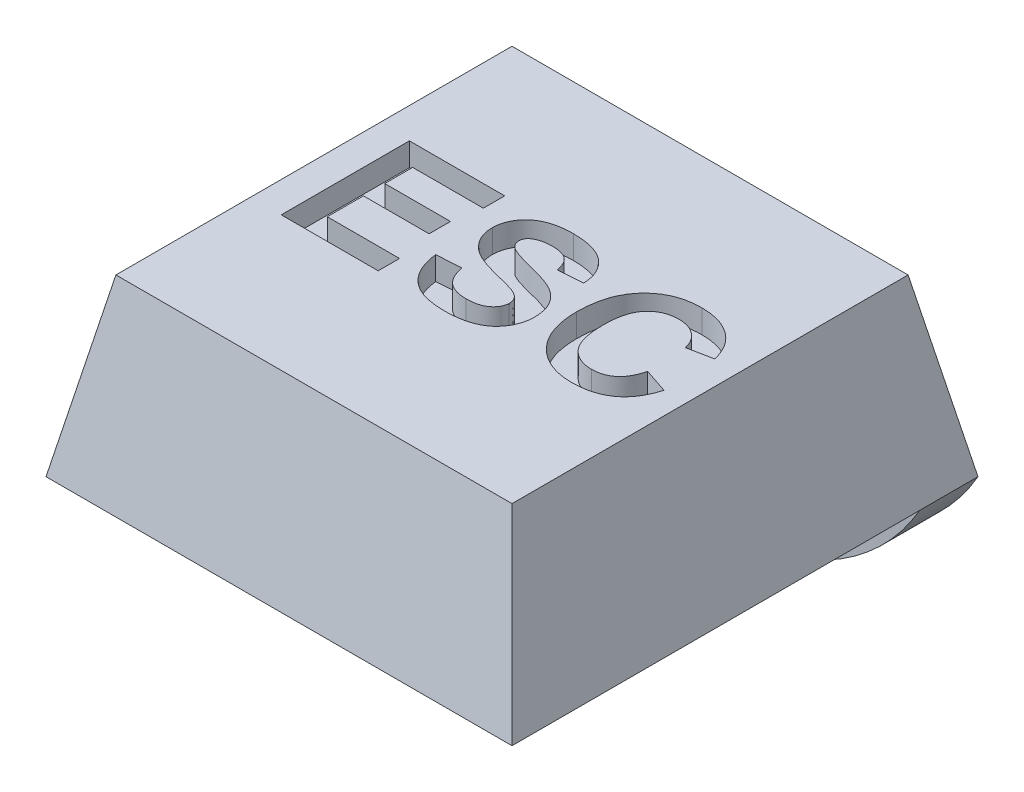
from build123d import *

# Parameters (mm, degrees)
SKETCH1_W               = 8
SKETCH1_H               = 8
BOSS_EXTRUDE1_DEPTH     = 3
CUT_EXTRUDE1_DEPTH      = 12.704699911
CUT_EXTRUDE1_DEPTH_BACK = 12.704699911
CUT_EXTRUDE2_DEPTH      = 11
SKETCH4_R               = 1.8
CUT_EXTRUDE3_DEPTH      = 0.8
SKETCH5_W               = 8
SKETCH5_H               = 1
BOSS_EXTRUDE2_DEPTH     = 2
FILLET1_R               = 4
CUT_EXTRUDE4_DEPTH      = 0.4


with BuildPart() as part:
    # Sketch1 → Boss-Extrude1 (new body)
    with BuildSketch(Plane(origin=(0, 0, 0), x_dir=(1, 0, 0), z_dir=(0, 1, 0))):
        with Locations((4, 4)):
            Rectangle(SKETCH1_W, SKETCH1_H)
    extrude(amount=BOSS_EXTRUDE1_DEPTH)

    # Sketch2 → Cut-Extrude1 (cut, two sides: drawn at the far end of the back side and taken through both)
    with BuildSketch(Plane.XY.offset(-CUT_EXTRUDE1_DEPTH_BACK)):
        Polygon((0, 0), (0.6, 3), (0, 3), align=None)
        Polygon((8, 0), (7.4, 3), (8, 3), align=None)
    extrude(amount=CUT_EXTRUDE1_DEPTH + CUT_EXTRUDE1_DEPTH_BACK, mode=Mode.SUBTRACT)

    # Sketch3 → Cut-Extrude2 (cut)
    with BuildSketch(Plane(origin=(0, 0, 0), x_dir=(0, 0, -1), z_dir=(1, 0, 0))):
        Polygon((0, 0), (0.6, 3), (0, 3), align=None)
        Polygon((8, 3), (7.4, 3), (8, 0), align=None)
    extrude(amount=CUT_EXTRUDE2_DEPTH, mode=Mode.SUBTRACT)

    # Sketch4 → Cut-Extrude3 (cut)
    with BuildSketch(Plane.XZ):
        with Locations(Location((4, -3.75, 0), (0, 0, 270))):
            Circle(SKETCH4_R)
    extrude(amount=-CUT_EXTRUDE3_DEPTH, mode=Mode.SUBTRACT)

    # Sketch5 → Boss-Extrude2 (add)
    with BuildSketch(Plane.XZ):
        with Locations((4, -7.5)):
            Rectangle(SKETCH5_W, SKETCH5_H)
    extrude(amount=BOSS_EXTRUDE2_DEPTH)

    # Fillet1
    # the kernel refuses this fillet: 4 mm, written as the material it takes off along each edge
    with BuildSketch(Plane(origin=(8, -2, -16.660254038), x_dir=(0, 1, 0), z_dir=(0, 0, 1)), Plane(origin=(0, -2, 1.660254038), x_dir=(0, 1, 0), z_dir=(0, 0, -1))) as fillet1_piece_1:
        with BuildLine():
            CenterArc((4, 3.464101615), FILLET1_R, 180, 60)
            Line((0, 3.464101615), (-0.08, 3.464101615))
            Line((-0.08, 3.464101615), (-0.08, 0))
            Line((-0.08, 0), (0, -0.08))
            ThreePointArc((0, -0.08), (1, -0.08), (1.96, -0.069282032))
            Line((1.96, -0.069282032), (2, 0))
        make_face()
    extrude(amount=18.320508076, mode=Mode.SUBTRACT)

    # Sketch6 → Cut-Extrude4 (cut)
    with BuildSketch(Plane(origin=(0, 3, 0), x_dir=(1, 0, 0), z_dir=(0, 1, 0))):
        Polygon((1.125870015, 2.912739384), (1.125870015, 5.112739384), (2.761767451, 5.112739384), (2.761767451, 4.746072718), (1.548946938, 4.746072718), (1.548946938, 4.266585538), (2.677152067, 4.266585538), (2.677152067, 3.899918872), (1.548946938, 3.899918872), (1.548946938, 3.279406051), (2.789972579, 3.279406051), (2.789972579, 2.912739384), align=None)
        with BuildLine():
            Line((3.043818733, 3.646072718), (3.466895656, 3.674277846))
            add(Edge.make_bspline(
                [(3.466895656, 3.674277846), (3.47026619, 3.656577797), (3.476813238, 3.622196579), (3.49135955, 3.573198648), (3.507371013, 3.527518681), (3.526505589, 3.485646517), (3.547453062, 3.446808174), (3.571934275, 3.412110062), (3.598241356, 3.380444359), (3.627676557, 3.352948362), (3.659745827, 3.328866988), (3.694609187, 3.30832959), (3.731888865, 3.290554101), (3.771676011, 3.275916549), (3.814380695, 3.264989545), (3.859630895, 3.25721563), (3.907491509, 3.252237429), (3.940200428, 3.251552081), (3.956959759, 3.251200923)],
                knots=[0, 0, 0, 0, 1.204560339, 2.339781841, 3.415289417, 4.440034832, 5.416475564, 6.362424008, 7.275913008, 8.16578645, 9.05021719, 9.95355393, 10.867835453, 11.809845306, 12.784702352, 13.812224031, 14.87903166, 16, 16, 16, 16], degree=3))
            add(Edge.make_bspline(
                [(3.956959759, 3.251200923), (3.974600015, 3.251393377), (4.008911222, 3.25176771), (4.058631954, 3.256411641), (4.105123098, 3.263064572), (4.147974119, 3.273596006), (4.187985219, 3.285373748), (4.22416269, 3.301486955), (4.257091969, 3.320071209), (4.286688222, 3.341159522), (4.3125169, 3.364547974), (4.335113116, 3.38896476), (4.354792928, 3.413882364), (4.370282333, 3.440406521), (4.3828177, 3.467464485), (4.3911027, 3.49586344), (4.396699709, 3.524951286), (4.397341522, 3.544830846), (4.397664887, 3.554846756)],
                knots=[0, 0, 0, 0, 1.417779877, 2.757654889, 4.012140507, 5.189587551, 6.302846416, 7.360586765, 8.365575446, 9.33904572, 10.275781718, 11.161696098, 12.012180333, 12.822428111, 13.625933072, 14.403138519, 15.195454004, 16, 16, 16, 16], degree=3))
            add(Edge.make_bspline(
                [(4.397664887, 3.554846756), (4.397268308, 3.567395879), (4.396492458, 3.591946401), (4.387152008, 3.627044061), (4.373144499, 3.659561029), (4.35205403, 3.689017029), (4.323703249, 3.71593552), (4.287539002, 3.741117109), (4.242551822, 3.763770691), (4.209177186, 3.776406901), (4.191414887, 3.783132013)],
                knots=[0, 0, 0, 0, 0.90494901, 1.770400303, 2.607161909, 3.452839393, 4.36912122, 5.420987164, 6.627424851, 8, 8, 8, 8], degree=3))
            add(Edge.make_bspline(
                [(4.191414887, 3.783132013), (4.183793555, 3.785685956), (4.166738252, 3.791401267), (4.137643715, 3.799573623), (4.102598573, 3.809778723), (4.061096401, 3.821378449), (4.013151153, 3.833241916), (3.959298316, 3.84785636), (3.898881364, 3.862398927), (3.856613592, 3.873134246), (3.834443733, 3.878765025)],
                knots=[0, 0, 0, 0, 0.521821638, 1.167752076, 1.961721917, 2.891982557, 3.96540661, 5.168436773, 6.514817513, 8, 8, 8, 8], degree=3))
            add(Edge.make_bspline(
                [(3.834443733, 3.878765025), (3.805571998, 3.885973624), (3.749868706, 3.899881436), (3.670423056, 3.924622448), (3.59725216, 3.949204014), (3.531060534, 3.975876331), (3.471118057, 4.002831746), (3.418394318, 4.031962707), (3.371789087, 4.06175634), (3.344631137, 4.084024829), (3.331599182, 4.094710538)],
                knots=[0, 0, 0, 0, 1.293880989, 2.496331788, 3.617634808, 4.64976062, 5.598842568, 6.473791081, 7.267636666, 8, 8, 8, 8], degree=3))
            add(Edge.make_bspline(
                [(3.331599182, 4.094710538), (3.315437863, 4.109842312), (3.283752103, 4.139509552), (3.242042718, 4.188258523), (3.206995477, 4.23975401), (3.178147761, 4.293615909), (3.155935566, 4.3501543), (3.140191847, 4.40899074), (3.13000194, 4.470278784), (3.12896213, 4.512017394), (3.128434118, 4.533212141)],
                knots=[0, 0, 0, 0, 1.064429417, 2.086912298, 3.078678339, 4.055528992, 5.020032834, 5.993708893, 6.981211098, 8, 8, 8, 8], degree=3))
            add(Edge.make_bspline(
                [(3.128434118, 4.533212141), (3.129462426, 4.560637891), (3.131502283, 4.615042392), (3.150209101, 4.695009582), (3.179349212, 4.772171761), (3.213144831, 4.833441389), (3.245615129, 4.879792095), (3.272579348, 4.913052937), (3.302202148, 4.944181887), (3.334889297, 4.972419613), (3.369427042, 4.999420158), (3.407153508, 5.023396966), (3.446999034, 5.045981793), (3.50466005, 5.072755055), (3.582947888, 5.100655423), (3.684804571, 5.124173662), (3.79570633, 5.138311162), (3.87259486, 5.140045534), (3.912448541, 5.140944513)],
                knots=[0, 0, 0, 0, 1.180131776, 2.341029169, 3.518901375, 4.725685298, 5.343762192, 5.955650671, 6.568945152, 7.192346361, 7.815201106, 8.455999361, 9.116257477, 9.787318263, 11.192748436, 12.688084276, 14.283332633, 16, 16, 16, 16], degree=3))
            add(Edge.make_bspline(
                [(3.912448541, 5.140944513), (3.945080768, 5.140508138), (4.008549753, 5.139659398), (4.100555419, 5.13107681), (4.186493702, 5.117719026), (4.266063037, 5.098543989), (4.339300495, 5.073208732), (4.406489968, 5.043029652), (4.467574359, 5.00719951), (4.521810028, 4.965512691), (4.570128811, 4.919555646), (4.612279221, 4.869357216), (4.648422408, 4.815551374), (4.678791636, 4.758177443), (4.702640511, 4.696940436), (4.720156568, 4.631916765), (4.73174184, 4.563259479), (4.734645724, 4.516214821), (4.736126426, 4.492226564)],
                knots=[0, 0, 0, 0, 1.325124071, 2.577337985, 3.749592149, 4.855247722, 5.896868755, 6.892903601, 7.842551483, 8.766257401, 9.665194363, 10.546067736, 11.423174165, 12.293291263, 13.177512979, 14.086532529, 15.024315359, 16, 16, 16, 16], degree=3))
            Line((4.736126426, 4.492226564), (4.313049502, 4.464021436))
            add(Edge.make_bspline(
                [(4.313049502, 4.464021436), (4.310608879, 4.477287993), (4.305852356, 4.503143134), (4.295510374, 4.540172949), (4.283845121, 4.574421305), (4.270191546, 4.60588798), (4.253699677, 4.634009379), (4.235751784, 4.659670214), (4.215852767, 4.682528569), (4.193343761, 4.701958509), (4.168998272, 4.719638959), (4.141252995, 4.733810248), (4.111270487, 4.746958085), (4.077910097, 4.756842035), (4.041812463, 4.764682339), (4.00295656, 4.77049463), (3.961261846, 4.773332518), (3.932577419, 4.773955523), (3.917737002, 4.774277846)],
                knots=[0, 0, 0, 0, 1.151066407, 2.24330871, 3.278475654, 4.238599069, 5.165719782, 6.056502506, 6.909492653, 7.744782051, 8.590364415, 9.471203867, 10.39832458, 11.382154319, 12.435022857, 13.550631277, 14.73277401, 16, 16, 16, 16], degree=3))
            add(Edge.make_bspline(
                [(3.917737002, 4.774277846), (3.902307022, 4.773993288), (3.872287307, 4.773439667), (3.82854058, 4.770042179), (3.787502868, 4.763770743), (3.748972622, 4.755606889), (3.713001312, 4.74450053), (3.679664846, 4.730958145), (3.648810708, 4.715014589), (3.6299972, 4.702470749), (3.620701746, 4.696273038)],
                knots=[0, 0, 0, 0, 1.186678824, 2.308736671, 3.37120409, 4.377216403, 5.334874112, 6.262130804, 7.141346615, 8, 8, 8, 8], degree=3))
            add(Edge.make_bspline(
                [(3.620701746, 4.696273038), (3.61006388, 4.687806789), (3.589461635, 4.671410293), (3.567289261, 4.638852427), (3.55394144, 4.602079293), (3.552334878, 4.576074512), (3.551511041, 4.562739384)],
                knots=[0, 0, 0, 0, 1.037857257, 2.010007357, 2.979541333, 4, 4, 4, 4], degree=3))
            add(Edge.make_bspline(
                [(3.551511041, 4.562739384), (3.55218479, 4.550276823), (3.553511967, 4.52572756), (3.56689826, 4.4908548), (3.587484556, 4.45854268), (3.606719073, 4.440990313), (3.6167354, 4.431849961)],
                knots=[0, 0, 0, 0, 0.98538058, 1.941042925, 2.927803204, 4, 4, 4, 4], degree=3))
            add(Edge.make_bspline(
                [(3.6167354, 4.431849961), (3.624684646, 4.425917415), (3.642447902, 4.412660642), (3.674986667, 4.395810029), (3.714261809, 4.377559798), (3.761168708, 4.359718182), (3.815395621, 4.341909685), (3.876945847, 4.323315555), (3.94585724, 4.304471782), (4.020373284, 4.28622251), (4.096028056, 4.268284525), (4.16822332, 4.248673243), (4.235354533, 4.229553761), (4.297110428, 4.209513441), (4.353809344, 4.190004251), (4.405175858, 4.169966908), (4.451562673, 4.150452778), (4.505654841, 4.123619468), (4.566962873, 4.087272664), (4.631220607, 4.034436522), (4.688048373, 3.975045249), (4.727644451, 3.919043375), (4.754844884, 3.870880273), (4.772359092, 3.832488672), (4.787510257, 3.792033606), (4.799843264, 3.749470368), (4.808781726, 3.704739066), (4.816178824, 3.658181449), (4.819958138, 3.609410844), (4.820477775, 3.576152762), (4.82074181, 3.559253808)],
                knots=[0, 0, 0, 0, 0.511875881, 1.143829537, 1.88775736, 2.750598373, 3.734912702, 4.837306479, 6.073130119, 7.42648979, 8.801963576, 10.091065733, 11.292408984, 12.408830014, 13.446061236, 14.39066453, 15.257936293, 16.045629259, 17.510392066, 18.929669597, 20.331293837, 21.746891395, 22.460690638, 23.187651344, 23.925159671, 24.69163991, 25.474819891, 26.281170188, 27.126635539, 28, 28, 28, 28], degree=3))
            add(Edge.make_bspline(
                [(4.82074181, 3.559253808), (4.820378753, 3.543669193), (4.819657756, 3.512719659), (4.814619235, 3.466782737), (4.806827289, 3.42166157), (4.795292532, 3.377299593), (4.7799905, 3.333784076), (4.762761628, 3.290486968), (4.741217893, 3.248352489), (4.716698184, 3.207345741), (4.689651831, 3.167497498), (4.65900329, 3.130738401), (4.626552736, 3.095842079), (4.590226664, 3.06476253), (4.552268292, 3.034983227), (4.510941443, 3.008610176), (4.467214345, 2.984744899), (4.420810518, 2.963565576), (4.371565435, 2.94510971), (4.319543056, 2.928682706), (4.264274691, 2.915238465), (4.206221198, 2.903715057), (4.145170128, 2.894951803), (4.081197808, 2.888833014), (4.014289695, 2.885382386), (3.968715741, 2.884820479), (3.945501426, 2.884534256)],
                knots=[0, 0, 0, 0, 0.900570041, 1.788444861, 2.667795364, 3.545012114, 4.433698372, 5.332345486, 6.235991676, 7.164928091, 8.092777575, 9.015680987, 9.928493428, 10.842962589, 11.775229507, 12.714851019, 13.672254427, 14.652424454, 15.660007982, 16.709910502, 17.803296389, 18.945495772, 20.129342395, 21.366102753, 22.658353839, 24, 24, 24, 24], degree=3))
            add(Edge.make_bspline(
                [(3.945501426, 2.884534256), (3.911983536, 2.885081493), (3.846723411, 2.886146975), (3.75191217, 2.895683882), (3.662985503, 2.910280806), (3.580088175, 2.931465866), (3.503118865, 2.958662702), (3.432112679, 2.992163198), (3.367413065, 3.032167502), (3.308218685, 3.077705443), (3.255318209, 3.129606836), (3.207749995, 3.186796305), (3.166155751, 3.249788831), (3.130562817, 3.318485884), (3.100071341, 3.392516091), (3.074924727, 3.471913444), (3.055990649, 3.557056626), (3.04794621, 3.61588751), (3.043818733, 3.646072718)],
                knots=[0, 0, 0, 0, 1.217954099, 2.371385517, 3.459848295, 4.490682126, 5.476952527, 6.422732854, 7.338496285, 8.236688651, 9.131557988, 10.026443255, 10.935708282, 11.869506048, 12.834296687, 13.842423496, 14.892981177, 16, 16, 16, 16], degree=3))
        make_face()
        with BuildLine():
            Line((6.597664887, 3.730688102), (7.02074181, 3.589662461))
            add(Edge.make_bspline(
                [(7.02074181, 3.589662461), (7.012143585, 3.561922373), (6.995305555, 3.507598554), (6.964388109, 3.429739623), (6.92903449, 3.357584202), (6.890516091, 3.290287759), (6.846437529, 3.22958878), (6.799266556, 3.173477559), (6.747600591, 3.123135903), (6.691694568, 3.078456317), (6.632086614, 3.038945186), (6.568084319, 3.005542852), (6.500642826, 2.976774288), (6.429078241, 2.953465685), (6.353865514, 2.934799032), (6.274651743, 2.922469607), (6.191807481, 2.914109849), (6.135240228, 2.913203448), (6.106278669, 2.912739384)],
                knots=[0, 0, 0, 0, 1.126640671, 2.206316847, 3.246446654, 4.24268115, 5.210795778, 6.153057602, 7.084219323, 8.004711971, 8.926421631, 9.854560063, 10.802134612, 11.768317461, 12.772025444, 13.805668576, 14.876536225, 16, 16, 16, 16], degree=3))
            add(Edge.make_bspline(
                [(6.106278669, 2.912739384), (6.070531543, 2.913478557), (6.000215876, 2.914932533), (5.897385873, 2.929568804), (5.799393529, 2.952404876), (5.706098662, 2.984021022), (5.618124, 3.025896526), (5.534666915, 3.076309204), (5.456334777, 3.136282516), (5.38340239, 3.204805679), (5.317141552, 3.281355594), (5.259843069, 3.365518608), (5.210883497, 3.456109066), (5.171311847, 3.553558916), (5.140369486, 3.657768094), (5.118694298, 3.768592513), (5.105131344, 3.886067083), (5.103586128, 3.966573938), (5.102793092, 4.007891628)],
                knots=[0, 0, 0, 0, 1.025049111, 2.016302254, 2.973197159, 3.90886983, 4.83646737, 5.763135642, 6.70136783, 7.661478232, 8.629732022, 9.600038443, 10.576877021, 11.5787097, 12.612181225, 13.690866959, 14.814907849, 16, 16, 16, 16], degree=3))
            add(Edge.make_bspline(
                [(5.102793092, 4.007891628), (5.103582553, 4.051412265), (5.105122647, 4.136313086), (5.11871101, 4.259751611), (5.139806133, 4.376085226), (5.170800791, 4.484592614), (5.20979093, 4.586037414), (5.258809944, 4.67941259), (5.315536876, 4.76596309), (5.38149699, 4.844102549), (5.454761758, 4.913479822), (5.533274019, 4.974828087), (5.617766221, 5.026294883), (5.707776005, 5.068381736), (5.803424088, 5.100950614), (5.904522262, 5.124402762), (6.011153243, 5.138053421), (6.084057374, 5.139967631), (6.121262644, 5.140944513)],
                knots=[0, 0, 0, 0, 1.212648312, 2.365655595, 3.457000981, 4.504219827, 5.506356588, 6.480637568, 7.437950897, 8.385265166, 9.323599949, 10.245787653, 11.157260172, 12.074946661, 13.00980897, 13.968233668, 14.963125779, 16, 16, 16, 16], degree=3))
            add(Edge.make_bspline(
                [(6.121262644, 5.140944513), (6.153755443, 5.140125778), (6.217461901, 5.138520541), (6.310753539, 5.127614498), (6.399167904, 5.108475121), (6.483182904, 5.082641218), (6.56232028, 5.048547339), (6.636721807, 5.006884969), (6.706643219, 4.957874546), (6.748772309, 4.919591601), (6.769980592, 4.900319513)],
                knots=[0, 0, 0, 0, 1.098510076, 2.153775193, 3.169777012, 4.153122333, 5.120892526, 6.076995459, 7.031936742, 8, 8, 8, 8], degree=3))
            add(Edge.make_bspline(
                [(6.769980592, 4.900319513), (6.782272635, 4.888056487), (6.807145451, 4.863242387), (6.840357641, 4.821349155), (6.871846924, 4.776251084), (6.901113501, 4.727178857), (6.927232384, 4.673761637), (6.951460438, 4.616819742), (6.973766298, 4.556133679), (6.986170922, 4.513899928), (6.992536682, 4.492226564)],
                knots=[0, 0, 0, 0, 0.885292881, 1.791380647, 2.722937556, 3.69093542, 4.703306561, 5.754477758, 6.847650944, 8, 8, 8, 8], degree=3))
            Line((6.992536682, 4.492226564), (6.569459759, 4.407611179))
            add(Edge.make_bspline(
                [(6.569459759, 4.407611179), (6.565863779, 4.421488127), (6.558780642, 4.448822073), (6.544448878, 4.488099452), (6.528009215, 4.525370177), (6.507633758, 4.559721358), (6.485989754, 4.592681181), (6.460364474, 4.622786129), (6.43239444, 4.650825186), (6.401878159, 4.676507375), (6.369179429, 4.699313747), (6.334927817, 4.719815256), (6.298500785, 4.736550893), (6.260382903, 4.750089984), (6.22072599, 4.761441491), (6.17917698, 4.768453847), (6.136092729, 4.773837069), (6.106737903, 4.774128767), (6.0917354, 4.774277846)],
                knots=[0, 0, 0, 0, 1.051226935, 2.070641259, 3.064374968, 4.034983734, 4.997599858, 5.953980297, 6.92954377, 7.901109626, 8.875958313, 9.851998019, 10.826131395, 11.811470594, 12.818270757, 13.847890818, 14.900111925, 16, 16, 16, 16], degree=3))
            add(Edge.make_bspline(
                [(6.0917354, 4.774277846), (6.071132245, 4.773861756), (6.030921051, 4.773049673), (5.97214623, 4.763995499), (5.916127146, 4.751359463), (5.863089719, 4.7320643), (5.813362398, 4.707385946), (5.766380029, 4.677386648), (5.722400475, 4.642194899), (5.681408872, 4.601393793), (5.64462448, 4.554245626), (5.612285749, 4.500653055), (5.585457873, 4.44000763), (5.563677904, 4.372904473), (5.546534587, 4.299184012), (5.534292909, 4.218751698), (5.527522893, 4.131552506), (5.526432863, 4.071217641), (5.525870015, 4.040063102)],
                knots=[0, 0, 0, 0, 0.938194206, 1.831074359, 2.704771284, 3.551924377, 4.396294915, 5.230222094, 6.087631332, 6.958733431, 7.860107878, 8.806247581, 9.804197948, 10.875520245, 12.017191412, 13.250061517, 14.580040491, 16, 16, 16, 16], degree=3))
            add(Edge.make_bspline(
                [(5.525870015, 4.040063102), (5.526427321, 4.006999524), (5.527501164, 3.943291101), (5.534269743, 3.851397593), (5.546589701, 3.766879877), (5.563505184, 3.689587962), (5.58539491, 3.61956919), (5.612177418, 3.556944728), (5.644016708, 3.501641236), (5.680863246, 3.45369554), (5.721785488, 3.412510334), (5.765675085, 3.377100434), (5.812273099, 3.346825109), (5.861859936, 3.321916524), (5.914624196, 3.303073456), (5.970132236, 3.289408133), (6.028587723, 3.28072087), (6.068640693, 3.279850467), (6.089091169, 3.279406051)],
                knots=[0, 0, 0, 0, 1.475208372, 2.842499301, 4.107722225, 5.282836115, 6.369007568, 7.375918121, 8.315702116, 9.208439171, 10.065831443, 10.90006451, 11.71996243, 12.54067204, 13.369972975, 14.214060185, 15.088124569, 16, 16, 16, 16], degree=3))
            add(Edge.make_bspline(
                [(6.089091169, 3.279406051), (6.104231956, 3.27978379), (6.134004064, 3.280526557), (6.178009536, 3.285240842), (6.220245815, 3.294237377), (6.260919633, 3.306133666), (6.300189022, 3.321059998), (6.337454994, 3.340207482), (6.373450743, 3.362214671), (6.407429383, 3.38800541), (6.439845908, 3.416960438), (6.469411701, 3.450425235), (6.49683643, 3.487595716), (6.521772168, 3.528720293), (6.5450521, 3.573446955), (6.564858784, 3.622472566), (6.583310486, 3.67500485), (6.592796514, 3.711802825), (6.597664887, 3.730688102)],
                knots=[0, 0, 0, 0, 0.980177776, 1.927374078, 2.859849964, 3.771585772, 4.668674471, 5.574490016, 6.479656464, 7.396337719, 8.332153134, 9.288470092, 10.28125149, 11.318486971, 12.398724812, 13.541284404, 14.738150009, 16, 16, 16, 16], degree=3))
        make_face()
    extrude(amount=-CUT_EXTRUDE4_DEPTH, mode=Mode.SUBTRACT)


solid = part.part
